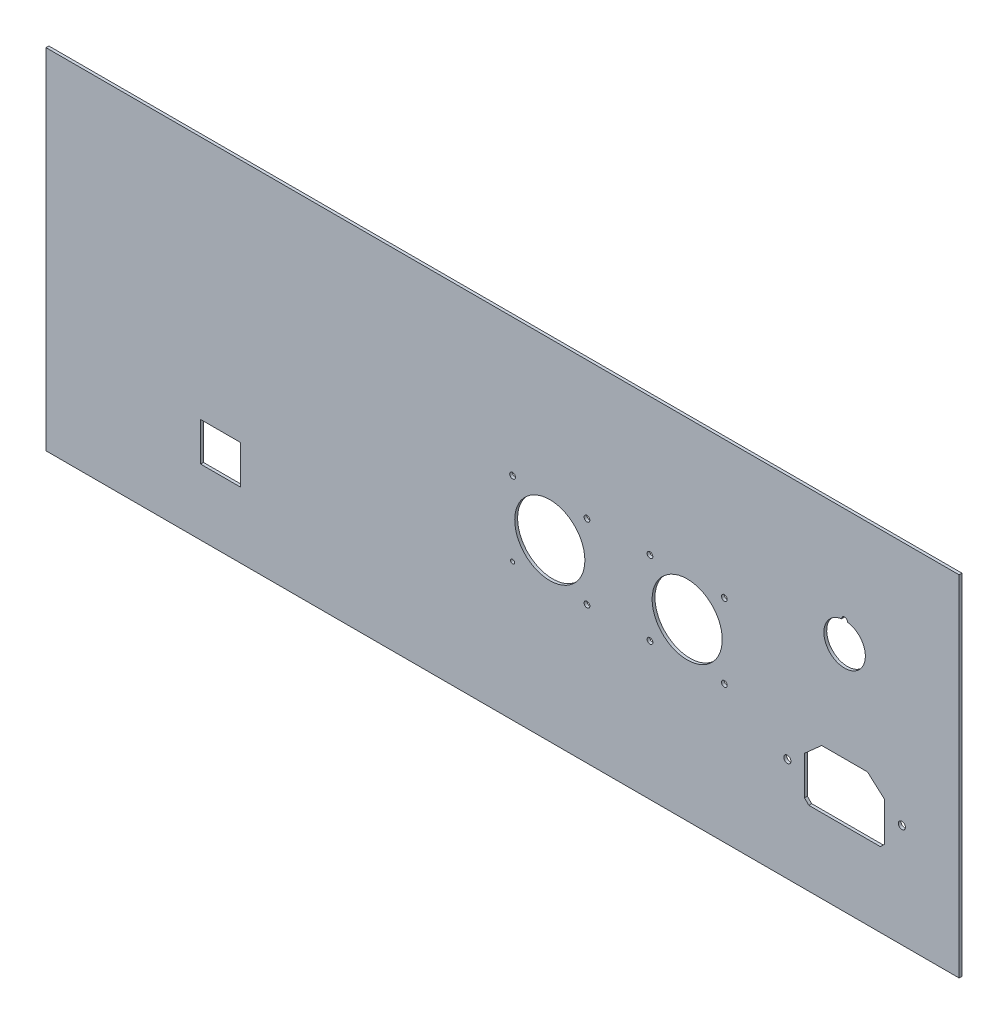
from build123d import *

# Parameters (mm, degrees)
SKETCH_1_W             = 319
SKETCH_1_H             = 122
SM_BASE_FLANGE_1_DEPTH = 1
SKETCH_2_R             = 12.25
CUT_EXTRUDE_1_DEPTH    = 10
SKETCH_3_R             = 1
SKETCH_3_R_2           = 0.707106781
CUT_EXTRUDE_2_DEPTH    = 10
CUT_EXTRUDE_3_DEPTH    = 10
SKETCH_5_R             = 1.25
CUT_EXTRUDE_4_DEPTH    = 10
CHAMFER_1_SIZE         = 1.5
SKETCH_6_W             = 14
SKETCH_6_H             = 13.5
CUT_EXTRUDE_5_DEPTH    = 10


# Sheet-metal steps are written as plain solids
with BuildPart() as part:
    # Sketch 1 → Базовая кромка1 (new body)
    with BuildSketch(Plane.XY):
        with Locations((101.800049421, -35.452668213)):
            Rectangle(SKETCH_1_W, SKETCH_1_H)
    extrude(amount=-SM_BASE_FLANGE_1_DEPTH)

    # Эскиз2 → Вырез-Вытянуть1 (cut)
    with BuildSketch(Plane(origin=(0, 0, -1), x_dir=(-1, 0, 0), z_dir=(0, 0, -1))):
        with Locations((-166.300049421, -35.452668213)):
            Circle(SKETCH_2_R)
        with Locations((-118.300049421, -35.452668213)):
            Circle(SKETCH_2_R)
        with BuildLine():
            ThreePointArc((-222.297668465, -8.271633731), (-221.300049421, -22.702668213), (-220.302430377, -8.271633731))
            ThreePointArc((-220.302430377, -8.271633731), (-221.300049421, -7.202668213), (-222.297668465, -8.271633731))
        make_face()
    extrude(amount=-CUT_EXTRUDE_1_DEPTH, mode=Mode.SUBTRACT)

    # Эскиз3 → Вырез-Вытянуть2 (cut)
    with BuildSketch(Plane(origin=(0, 0, -1), x_dir=(-1, 0, 0), z_dir=(0, 0, -1))):
        with Locations((-179.300049421, -22.452668213)):
            Circle(SKETCH_3_R)
        with Locations((-153.300049421, -22.452668213)):
            Circle(SKETCH_3_R)
        with Locations((-179.300049421, -48.452668213)):
            Circle(SKETCH_3_R)
        with Locations((-153.300049421, -48.452668213)):
            Circle(SKETCH_3_R)
        with Locations((-131.300049421, -48.452668213)):
            Circle(SKETCH_3_R)
        with Locations((-105.300049421, -48.452668213)):
            Circle(SKETCH_3_R_2)
        with Locations((-131.300049421, -22.452668213)):
            Circle(SKETCH_3_R)
        with Locations((-105.300049421, -22.452668213)):
            Circle(SKETCH_3_R)
    extrude(amount=-CUT_EXTRUDE_2_DEPTH, mode=Mode.SUBTRACT)

    # Эскиз4 → Вырез-Вытянуть3 (cut)
    with BuildSketch(Plane(origin=(0, 0, -1), x_dir=(-1, 0, 0), z_dir=(0, 0, -1))):
        Polygon((-213.300049421, -50.101915565), (-207.300049421, -55.452668213), (-207.300049421, -70.452668213), (-235.300049421, -70.452668213), (-235.300049421, -55.452668213), (-229.300049421, -50.101915565), align=None)
    extrude(amount=-CUT_EXTRUDE_3_DEPTH, mode=Mode.SUBTRACT)

    # Эскиз5 → Вырез-Вытянуть4 (cut)
    with BuildSketch(Plane(origin=(0, 0, -1), x_dir=(-1, 0, 0), z_dir=(0, 0, -1))):
        with Locations((-241.300049425, -60.275234132)):
            Circle(SKETCH_5_R)
        with Locations((-201.300049425, -60.275234132)):
            Circle(SKETCH_5_R)
    extrude(amount=-CUT_EXTRUDE_4_DEPTH, mode=Mode.SUBTRACT)

    # Фаска1
    chamfer_1_edges = [part.edges().sort_by_distance(p)[0] for p in [
        (207.300049421, -70.452668213, -0.5),
        (235.300049421, -70.452668213, -0.5),
    ]]
    chamfer(chamfer_1_edges, length=CHAMFER_1_SIZE)

    # Эскиз6 → Вырез-Вытянуть5 (cut)
    with BuildSketch(Plane(origin=(0, 0, -1), x_dir=(-1, 0, 0), z_dir=(0, 0, -1))):
        with Locations((-3.300049421, -66.702668213)):
            Rectangle(SKETCH_6_W, SKETCH_6_H)
    extrude(amount=-CUT_EXTRUDE_5_DEPTH, mode=Mode.SUBTRACT)


solid = part.part
